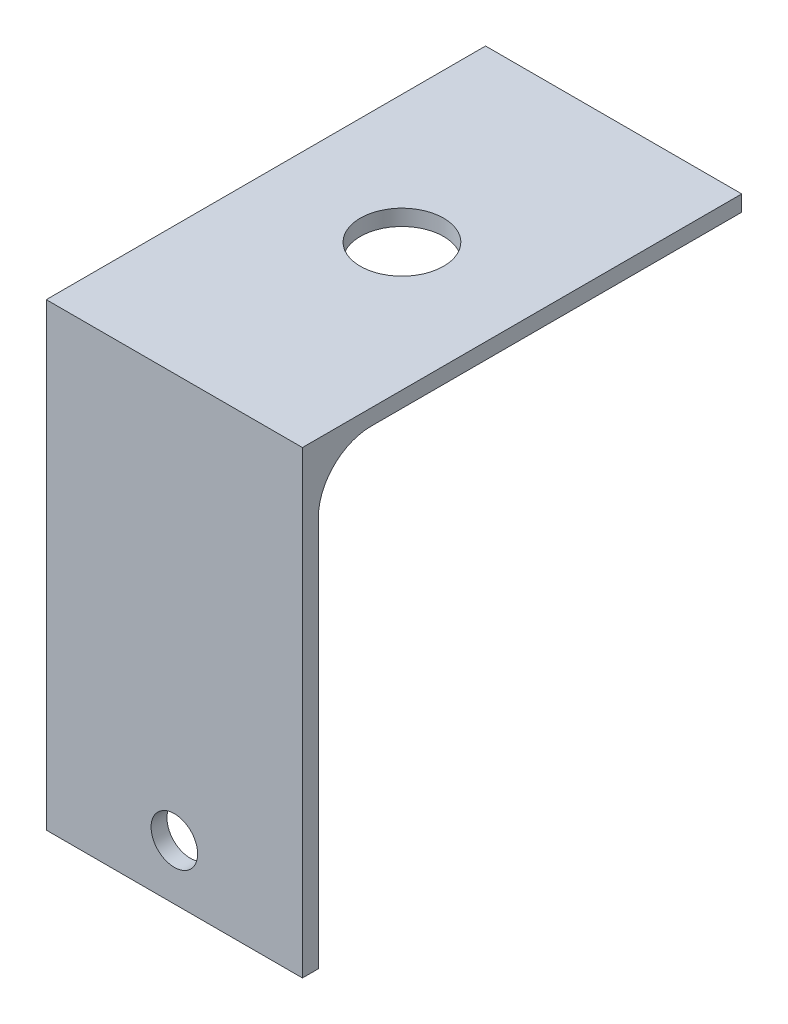
from build123d import *

# Parameters (mm, degrees)
SKETCH1_W           = 24.2
SKETCH1_H           = 43.4
BOSS_EXTRUDE1_DEPTH = 1.5
SKETCH2_R           = 2.2
CUT_EXTRUDE1_DEPTH  = 25.890761338
SKETCH4_W           = 24.2
SKETCH4_H           = 40
BOSS_EXTRUDE2_DEPTH = 1.5
SKETCH5_R           = 3.937
CUT_EXTRUDE2_DEPTH  = 60.177867484
FILLET1_R           = 5


with BuildPart() as part:
    # Sketch1 → Boss-Extrude1 (new body)
    with BuildSketch(Plane.XY):
        Rectangle(SKETCH1_W, SKETCH1_H)
    extrude(amount=BOSS_EXTRUDE1_DEPTH)

    # Sketch2 → Cut-Extrude1 (cut, through all)
    with BuildSketch(Plane.XY.offset(1.5)):
        with Locations((0, -16.5)):
            Circle(SKETCH2_R)
    extrude(amount=-CUT_EXTRUDE1_DEPTH, mode=Mode.SUBTRACT)

    # Sketch4 → Boss-Extrude2 (add)
    with BuildSketch(Plane(origin=(0, 21.7, 0), x_dir=(1, 0, 0), z_dir=(0, 1, 0))):
        with Locations((0, 20)):
            Rectangle(SKETCH4_W, SKETCH4_H)
    extrude(amount=-BOSS_EXTRUDE2_DEPTH)

    # Sketch5 → Cut-Extrude2 (cut, through all)
    with BuildSketch(Plane.XZ.offset(-20.2)):
        with Locations((0, -20)):
            Circle(SKETCH5_R)
    extrude(amount=-CUT_EXTRUDE2_DEPTH, mode=Mode.SUBTRACT)

    # Fillet1
    fillet1_edges = [part.edges().sort_by_distance(p)[0] for p in [
        (0, 20.2, 0),
    ]]
    fillet(fillet1_edges, radius=FILLET1_R)


solid = part.part
